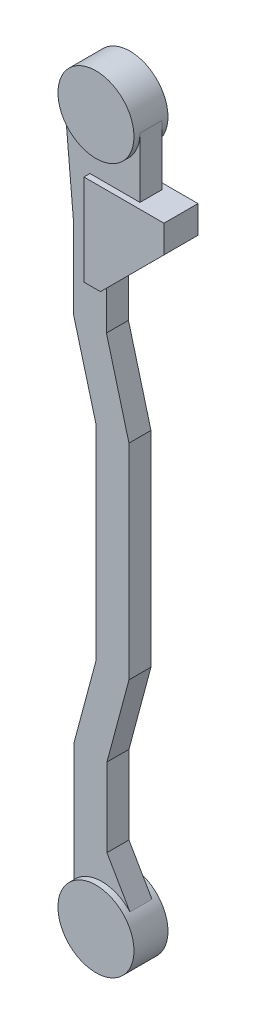
from build123d import *
from build123d.topology import SkipClean

# Parameters (mm, degrees)
BOSS_EXTRUDE1_DEPTH      = 11
BOSS_EXTRUDE1_DEPTH_BACK = 11
BOSS_EXTRUDE2_DEPTH      = 17
BOSS_EXTRUDE2_DEPTH_BACK = 17
SKETCH3_R                = 38


with BuildPart() as part:
    # Sketch1 → Boss-Extrude1 (new, two sides: drawn at the far end of the back side and taken through both)
    with BuildSketch(Plane.XY.offset(-BOSS_EXTRUDE1_DEPTH_BACK)):
        with BuildLine():
            Line((-28, 144), (-28, 25.690465157))
            ThreePointArc((-28, 25.690465157), (0, -38), (28, 25.690465157))
            Line((28, 25.690465157), (5, 65.527633731))
            Line((5, 65.527633731), (5, 144))
            Line((5, 144), (26.999618834, 226.103695235))
            Line((26.999618834, 226.103695235), (26.999618834, 431.103695235))
            Line((26.999618834, 431.103695235), (4.48236191, 515.139242122))
            Line((4.48236191, 515.139242122), (4.48236191, 553.98236191))
            Line((4.48236191, 553.98236191), (68, 617.5))
            Line((68, 617.5), (68, 645))
            Line((68, 645), (38, 645))
            Line((38, 645), (38, 705))
            ThreePointArc((38, 705), (-1.675998364, 742.96302187), (-37.852159447, 701.651265129))
            Line((-37.852159447, 701.651265129), (-28.51763809, 596.139242122))
            Line((-28.51763809, 596.139242122), (-28.51763809, 515.139242122))
            Line((-28.51763809, 515.139242122), (-6.000381166, 431.103695235))
            Line((-6.000381166, 431.103695235), (-6.000381166, 226.103695235))
            Line((-6.000381166, 226.103695235), (-28, 144))
        make_face()
    extrude(amount=BOSS_EXTRUDE1_DEPTH + BOSS_EXTRUDE1_DEPTH_BACK)

    # Sketch3 → Boss-Extrude2 (add, two sides: drawn at the far end of the back side and taken through both)
    with SkipClean():  # the faces are left unmerged after this step: merging them gives an invalid solid
        with BuildSketch(Plane.XY.offset(-BOSS_EXTRUDE2_DEPTH_BACK)):
            with Locations((0, 705)):
                Circle(SKETCH3_R)
            Circle(SKETCH3_R)
            Polygon((68, 617.5), (4.48236191, 553.98236191), (-12, 553.98236191), (-12, 645), (68, 645), align=None)
        extrude(amount=BOSS_EXTRUDE2_DEPTH + BOSS_EXTRUDE2_DEPTH_BACK)
    add(part.part.scale(1), mode=Mode.REPLACE)  # the faces are merged on a copy


solid = part.part
